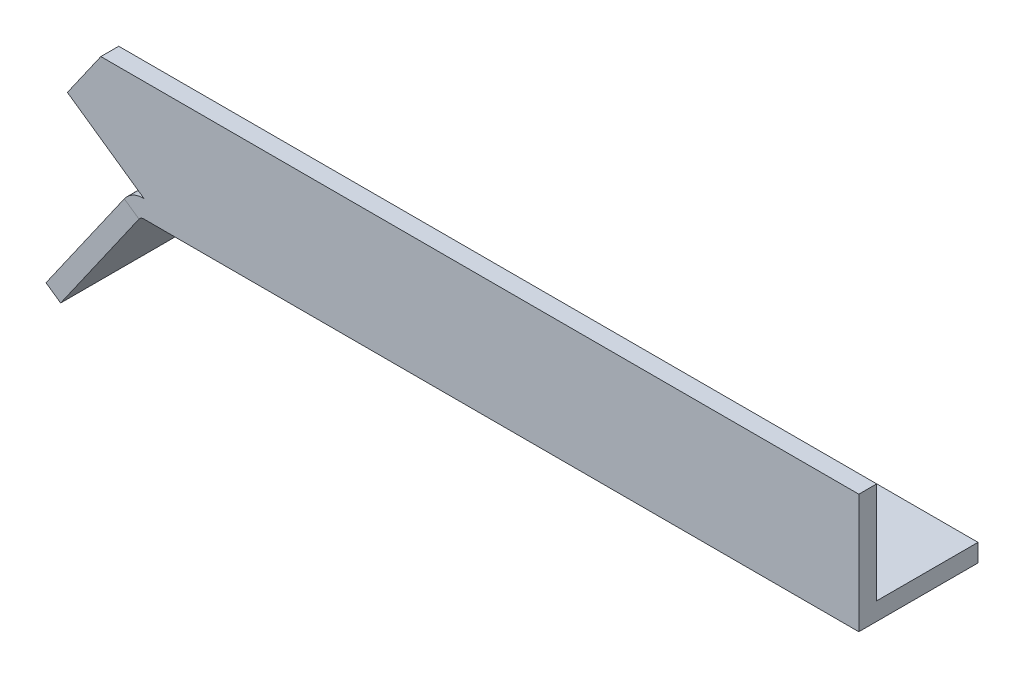
from build123d import *

# Parameters (mm, degrees)
EXTRUDE_1_DEPTH        = 120
SKETCH_3_W             = 120
SKETCH_3_H             = 20
SM_BASE_FLANGE_1_DEPTH = 3
SM_EDGE_FLANGE_1_DEPTH = 20
EXTRUDE_1_2_DEPTH      = 3


# Sheet-metal steps are written as plain solids
with BuildPart() as part:
    # Sketch 1 → Extrude 1 (new body)
    with BuildSketch(Plane(origin=(0, 0, 0), x_dir=(0, 0, -1), z_dir=(1, 0, 0))):
        Polygon((0, 20), (0, 0), (20, 0), (20, 3), (3, 3), (3, 20), align=None)
    extrude(amount=EXTRUDE_1_DEPTH)



with BuildPart() as body_2:
    # Эскиз3 → Базовая кромка1 (new body)
    with BuildSketch(Plane.XZ):
        with Locations((60, -10)):
            Rectangle(SKETCH_3_W, SKETCH_3_H)
    extrude(amount=-SM_BASE_FLANGE_1_DEPTH)

    # Ребро-кромка1 section (across the edge) → Ребро-кромка1 (add)
    with BuildSketch(Plane(origin=(-0.520567051, 0, 0), x_dir=(0.8191520442889892, -0.5735764363510499, 0), z_dir=(0, 0, -1))):
        with BuildLine():
            Line((-3, 0.520567051), (-3, 23.438298848))
            Line((-3, 23.438298848), (0, 23.438298848))
            Line((0, 23.438298848), (0, 0.520567051))
            ThreePointArc((0, 0.520567051), (0.112989167, 0.058818437), (0.426423564, -0.298584994))
            Line((0.426423564, -0.298584994), (-1.294305745, -2.756041127))
            ThreePointArc((-1.294305745, -2.756041127), (-2.548043333, -1.326427402), (-3, 0.520567051))
        make_face()
    extrude(amount=SM_EDGE_FLANGE_1_DEPTH)


with BuildPart() as part_1:
    add(part.part)

    add(body_2.part)  # Extrude 1 2 merges body 2
    # Эскиз11 → Extrude 1 2 (add)
    with BuildSketch(Plane.XY):
        Polygon((0, 20), (0, 3), (-12.829726495, 11.983471205), (-7.216492602, 20), align=None)
    extrude(amount=-EXTRUDE_1_2_DEPTH)


solid = part_1.part
